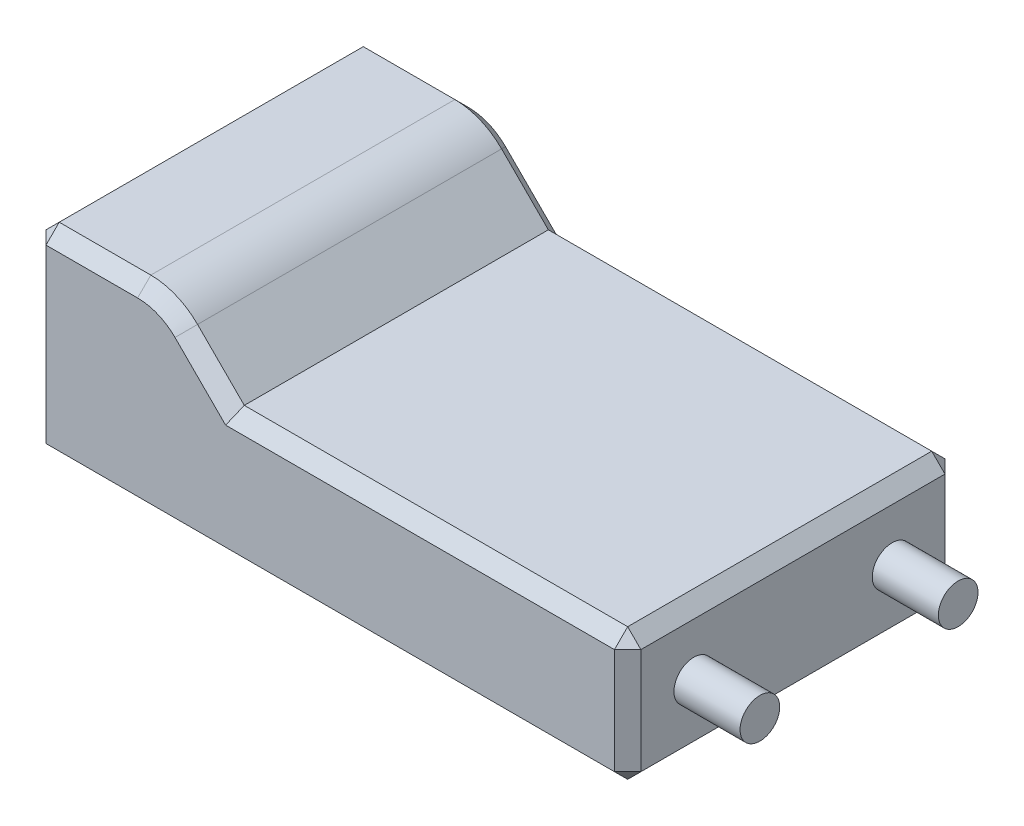
from build123d import *

# Parameters (mm, degrees)
SKETCH_1_W          = 35
SKETCH_1_H          = 25
EXTRUDE_1_DEPTH     = 10
SKETCH_1_4_W        = 10
SKETCH_1_4_H        = 25
EXTRUDE_2_DEPTH     = 15
SKETCH_2_W          = 10
SKETCH_2_H          = 13
CUT_EXTRUDE_1_DEPTH = 7
EXTRUDE_3_DEPTH     = 25
FILLET_1_R          = 5
CHAMFER_1_SIZE      = 1
SKETCH_5_R          = 1.5
EXTRUDE_4_DEPTH     = 5


with BuildPart() as part:
    # 草图1 → 凸台-拉伸1 (new body)
    with BuildSketch(Plane(origin=(0, 0, 0), x_dir=(1, 0, 0), z_dir=(0, 1, 0))):
        with Locations((5, 0)):
            Rectangle(SKETCH_1_W, SKETCH_1_H)
    extrude(amount=EXTRUDE_1_DEPTH)

    # 草图1<4> → 凸台-拉伸2 (add)
    with BuildSketch(Plane(origin=(0, 0, 0), x_dir=(1, 0, 0), z_dir=(0, 1, 0))):
        with Locations((-17.5, 0)):
            Rectangle(SKETCH_1_4_W, SKETCH_1_4_H)
    extrude(amount=EXTRUDE_2_DEPTH)

    # 草图2 → 切除-拉伸1 (cut)
    with BuildSketch(Plane.ZY.offset(22.5)):
        with Locations((5, 7.5)):
            Rectangle(SKETCH_2_W, SKETCH_2_H)
        with Locations((-5, 7.5)):
            Rectangle(SKETCH_2_W, SKETCH_2_H)
    extrude(amount=-CUT_EXTRUDE_1_DEPTH, mode=Mode.SUBTRACT)

    # 草图3 → 凸台-拉伸3 (add, through all)
    with BuildSketch(Plane.XY.offset(12.5)):
        Polygon((-7.5, 10), (-12.5, 15), (-12.5, 12.5), (-12.5, 10), (-10, 10), align=None)
    extrude(amount=-EXTRUDE_3_DEPTH)

    # 圆角1
    fillet_1_edges = [part.edges().sort_by_distance(p)[0] for p in [
        (-12.5, 15, 0),
    ]]
    fillet(fillet_1_edges, radius=FILLET_1_R)

    # 倒角1
    chamfer_1_edges = [part.edges().sort_by_distance(p)[0] for p in [
        (-18.535533906, 15, -12.5),
        (-22.5, 0, 0),
        (-22.5, 7.5, -12.5),
        (-22.5, 7.5, 12.5),
        (-22.5, 15, 0),
        (-18.535533906, 15, 12.5),
        (22.5, 10, 0),
        (7.5, 10, -12.5),
        (7.5, 10, 12.5),
        (-9.267766953, 11.767766953, 12.5),
        (-9.267766953, 11.767766953, -12.5),
        (22.5, 0, 0),
        (-12.65765065, 14.619397663, 12.5),
        (-12.65765065, 14.619397663, -12.5),
        (0, 0, 12.5),
        (0, 0, -12.5),
        (22.5, 5, -12.5),
        (22.5, 5, 12.5),
    ]]
    chamfer(chamfer_1_edges, length=CHAMFER_1_SIZE - 0.0001)  # a hair under: the kernel refuses the full size

    # 草图5 → 凸台-拉伸4 (add)
    with BuildSketch(Plane(origin=(22.5, 0, 0), x_dir=(0, 0, -1), z_dir=(1, 0, 0))):
        with Locations((-7.5, 5)):
            Circle(SKETCH_5_R)
        with Locations((7.5, 5)):
            Circle(SKETCH_5_R)
    extrude(amount=EXTRUDE_4_DEPTH)


solid = part.part
